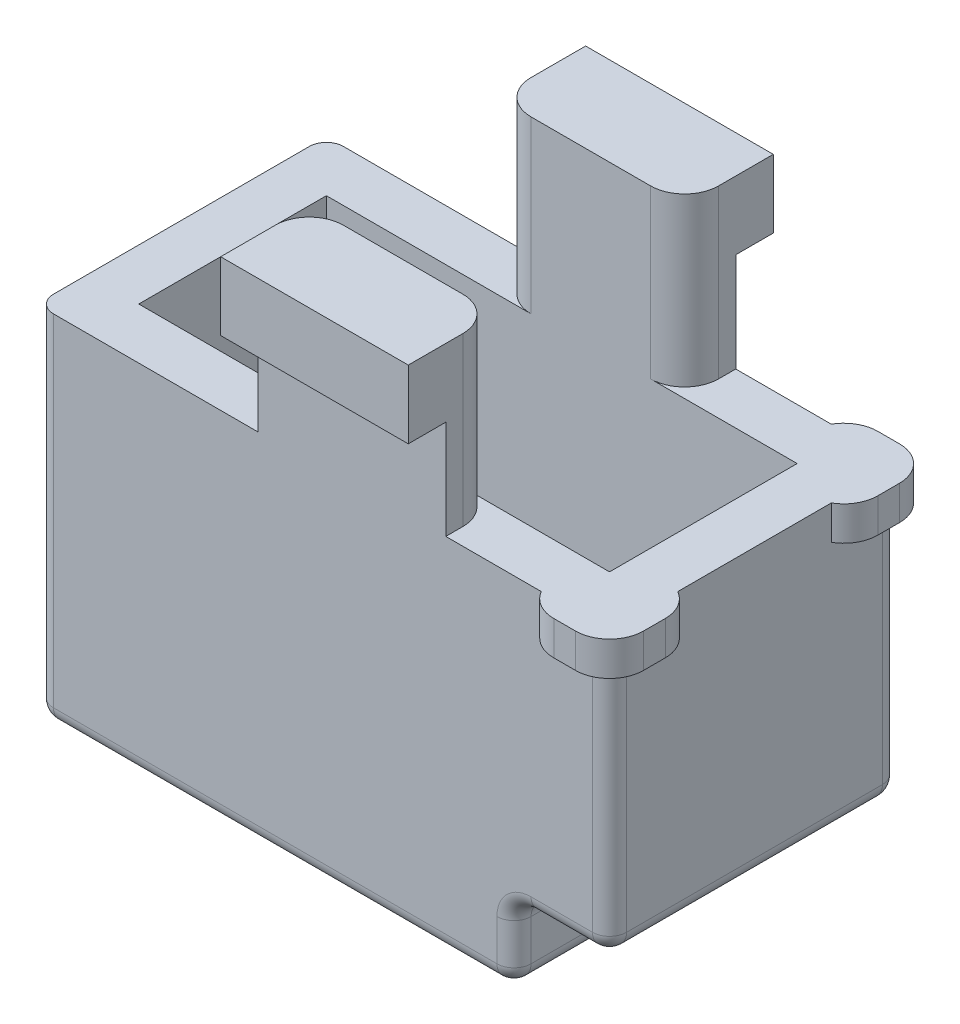
from build123d import *

# Parameters (mm, degrees)
BOSS_EXTRUDE1_DEPTH = 8.5
SHELL1_T            = -1.5
SKETCH3_W           = 14
SKETCH3_H           = 8.5
BOSS_EXTRUDE2_DEPTH = 1.5
CUT_EXTRUDE1_DEPTH  = 0.5
BOSS_EXTRUDE4_DEPTH = 1
FILLET2_R           = 1
SKETCH6_W           = 5.5
SKETCH6_H           = 2.6
BOSS_EXTRUDE5_DEPTH = 2
FILLET3_R           = 0.5
FILLET4_R           = 1


with BuildPart() as part:
    # Sketch1 → Boss-Extrude1 (new body)
    with BuildSketch(Plane.XY):
        Polygon((0, 0), (-6.5, 0), (-6.5, -10.5), (7.5, -10.5), (7.5, -8.3), (10.3, -8.3), (10.3, 0.1), (5.5, 0.1), (5.5, 5), (0, 5), align=None)
    extrude(amount=BOSS_EXTRUDE1_DEPTH)

    # Shell1
    shell1_openings = [part.faces().sort_by_distance(p)[0] for p in [
        (2.75, 5, 4.25),
        (5.5, 2.55, 4.25),
        (7.9, 0.1, 4.25),
        (0.5, -10.5, 4.25),
        (-3.25, 0, 4.25),
        (0, 2.5, 4.25),
    ]]
    offset(amount=SHELL1_T, openings=shell1_openings, kind=Kind.INTERSECTION)

    # Sketch3 → Boss-Extrude2 (add)
    with BuildSketch(Plane.XZ.offset(10.5)):
        with Locations((0.5, 4.25)):
            Rectangle(SKETCH3_W, SKETCH3_H)
    extrude(amount=-BOSS_EXTRUDE2_DEPTH)

    # Sketch4 → Cut-Extrude1 (cut)
    with BuildSketch(Plane.XZ.offset(10.5)):
        with BuildLine():
            Line((-3, 3.75), (-4.058316713, 1.916941682))
            ThreePointArc((-4.058316713, 1.916941682), (-3.875304011, 1.23392898), (-3.192291309, 1.416941682))
            Line((-3.192291309, 1.416941682), (-1.845299462, 3.75))
            Line((-1.845299462, 3.75), (-0.464100143, 3.75))
            Line((-0.464100143, 3.75), (-1.522416856, 1.916941682))
            ThreePointArc((-1.522416856, 1.916941682), (-1.339404154, 1.23392898), (-0.656391453, 1.416941682))
            Line((-0.656391453, 1.416941682), (0.690600395, 3.75))
            Line((0.690600395, 3.75), (2.071799714, 3.75))
            Line((2.071799714, 3.75), (1.013483001, 1.916941682))
            ThreePointArc((1.013483001, 1.916941682), (1.196495702, 1.23392898), (1.879508404, 1.416941682))
            Line((1.879508404, 1.416941682), (3.226500252, 3.75))
            Line((3.226500252, 3.75), (4.607699571, 3.75))
            Line((4.607699571, 3.75), (3.549382857, 1.916941682))
            ThreePointArc((3.549382857, 1.916941682), (3.732395559, 1.23392898), (4.415408261, 1.416941682))
            Line((4.415408261, 1.416941682), (5.762400109, 3.75))
            Line((5.762400109, 3.75), (5.90585335, 3.998468302))
            ThreePointArc((5.90585335, 3.998468302), (5.972840648, 4.248468302), (5.90585335, 4.498468302))
            Line((5.90585335, 4.498468302), (5.762400109, 4.746936604))
            Line((5.762400109, 4.746936604), (4.415408261, 7.079994922))
            ThreePointArc((4.415408261, 7.079994922), (3.732395559, 7.263007624), (3.549382857, 6.579994922))
            Line((3.549382857, 6.579994922), (4.607699571, 4.746936604))
            Line((4.607699571, 4.746936604), (3.226500252, 4.746936604))
            Line((3.226500252, 4.746936604), (1.879508404, 7.079994922))
            ThreePointArc((1.879508404, 7.079994922), (1.196495702, 7.263007624), (1.013483001, 6.579994922))
            Line((1.013483001, 6.579994922), (2.071799714, 4.746936604))
            Line((2.071799714, 4.746936604), (0.690600395, 4.746936604))
            Line((0.690600395, 4.746936604), (-0.656391453, 7.079994922))
            ThreePointArc((-0.656391453, 7.079994922), (-1.339404154, 7.263007624), (-1.522416856, 6.579994922))
            Line((-1.522416856, 6.579994922), (-0.464100143, 4.746936604))
            Line((-0.464100143, 4.746936604), (-1.845299462, 4.746936604))
            Line((-1.845299462, 4.746936604), (-3.192291309, 7.079994922))
            ThreePointArc((-3.192291309, 7.079994922), (-3.875304011, 7.263007624), (-4.058316713, 6.579994922))
            Line((-4.058316713, 6.579994922), (-3, 4.746936604))
            Line((-3, 4.746936604), (-2.856546759, 4.498468302))
            ThreePointArc((-2.856546759, 4.498468302), (-2.789559461, 4.248468302), (-2.856546759, 3.998468302))
            Line((-2.856546759, 3.998468302), (-3, 3.75))
        make_face()
    extrude(amount=-CUT_EXTRUDE1_DEPTH, mode=Mode.SUBTRACT)

    # Sketch5 → Boss-Extrude4 (add)
    with BuildSketch(Plane(origin=(0, 0.1, 0), x_dir=(1, 0, 0), z_dir=(0, 1, 0))):
        Polygon((10.3, 0.5), (8.3, 0.5), (8.3, 0), (10.3, 0), (10.3, -2), (10.8, -2), (10.8, 0.5), align=None)
        Polygon((10.8, -6.5), (10.3, -6.5), (10.3, -8.5), (8.3, -8.5), (8.3, -9), (10.3, -9), (10.8, -9), align=None)
    extrude(amount=-BOSS_EXTRUDE4_DEPTH)

    # Fillet2
    # the kernel refuses this fillet: 1 mm, written as the material it takes off along each edge
    with BuildSketch(Plane(origin=(8.3, 2.265063509, -0.5), x_dir=(0, 0, 1), z_dir=(0, -1, 0)), Plane(origin=(10.8, 2.265063509, 6.5), x_dir=(-1, 0, 0), z_dir=(0, -1, 0))) as fillet2_piece_1:
        with BuildLine():
            CenterArc((1, -0.866025404), FILLET2_R, 120, 60)
            Line((0, -0.866025404), (-0.02, -0.866025404))
            Line((-0.02, -0.866025404), (-0.02, 0))
            Line((-0.02, 0), (0, 0.02))
            ThreePointArc((0, 0.02), (0.25, 0.02), (0.49, 0.017320508))
            Line((0.49, 0.017320508), (0.5, 0))
        make_face()
    extrude(amount=5.330127019, mode=Mode.SUBTRACT)
    with BuildSketch(Plane(origin=(10.8, 2.265063509, 2), x_dir=(-1, 0, 0), z_dir=(0, -1, 0)), Plane(origin=(8.3, 2.265063509, 9), x_dir=(0, 0, -1), z_dir=(0, -1, 0))) as fillet2_piece_2:
        with BuildLine():
            CenterArc((1, 0.866025404), FILLET2_R, 180, 60)
            Line((0, 0.866025404), (-0.02, 0.866025404))
            Line((-0.02, 0.866025404), (-0.02, 0))
            Line((-0.02, 0), (0, -0.02))
            ThreePointArc((0, -0.02), (0.25, -0.02), (0.49, -0.017320508))
            Line((0.49, -0.017320508), (0.5, 0))
        make_face()
    extrude(amount=5.330127019, mode=Mode.SUBTRACT)
    with BuildSketch(Plane(origin=(10.8, 2.6, -0.5), x_dir=(-1, 0, 0), z_dir=(0, -1, 0))) as fillet2_piece_3:
        with BuildLine():
            CenterArc((FILLET2_R, -FILLET2_R), FILLET2_R, 90, 90)
            Line((0, -FILLET2_R), (-FILLET2_R * 0.02, -FILLET2_R))
            Line((-FILLET2_R * 0.02, -FILLET2_R), (-FILLET2_R * 0.02, FILLET2_R * 0.02))
            Line((-FILLET2_R * 0.02, FILLET2_R * 0.02), (FILLET2_R, FILLET2_R * 0.02))
            Line((FILLET2_R, FILLET2_R * 0.02), (FILLET2_R, 0))
        make_face()
    extrude(amount=6, mode=Mode.SUBTRACT)
    with BuildSketch(Plane(origin=(10.8, 2.6, 9), x_dir=(-1, 0, 0), z_dir=(0, -1, 0))) as fillet2_piece_4:
        with BuildLine():
            CenterArc((FILLET2_R, FILLET2_R), FILLET2_R, 180, 90)
            Line((0, FILLET2_R), (-FILLET2_R * 0.02, FILLET2_R))
            Line((-FILLET2_R * 0.02, FILLET2_R), (-FILLET2_R * 0.02, -FILLET2_R * 0.02))
            Line((-FILLET2_R * 0.02, -FILLET2_R * 0.02), (FILLET2_R, -FILLET2_R * 0.02))
            Line((FILLET2_R, -FILLET2_R * 0.02), (FILLET2_R, 0))
        make_face()
    extrude(amount=6, mode=Mode.SUBTRACT)

    # Sketch6 → Boss-Extrude5 (add)
    with BuildSketch(Plane(origin=(0, 5, 0), x_dir=(1, 0, 0), z_dir=(0, 1, 0))):
        with Locations((2.75, -8.3)):
            Rectangle(SKETCH6_W, SKETCH6_H)
        with Locations((2.75, -0.2)):
            Rectangle(SKETCH6_W, SKETCH6_H)
    extrude(amount=-BOSS_EXTRUDE5_DEPTH)

    # Fillet3
    fillet3_edges = [part.edges().sort_by_distance(p)[0] for p in [
        (10.3, -4.6, 0),
        (8.9, -8.3, 0),
        (7.5, -9.4, 0),
        (0.5, -10.5, 0),
        (-6.5, -5.25, 8.5),
        (-6.5, -5.25, 0),
        (0.5, -10.5, 8.5),
        (10.3, -8.3, 4.25),
        (7.5, -8.3, 4.25),
        (7.5, -10.5, 4.25),
        (-6.5, -10.5, 4.25),
        (7.5, -9.4, 8.5),
        (8.9, -8.3, 8.5),
        (10.3, -4.6, 8.5),
    ]]
    fillet(fillet3_edges, radius=FILLET3_R)

    # Fillet4
    fillet4_edges = [part.edges().sort_by_distance(p)[0] for p in [
        (0, 2.5, 1.5),
        (5.5, 2.55, 1.5),
        (0, 2.5, 7),
        (5.5, 2.55, 7),
    ]]
    fillet(fillet4_edges, radius=FILLET4_R)


solid = part.part
